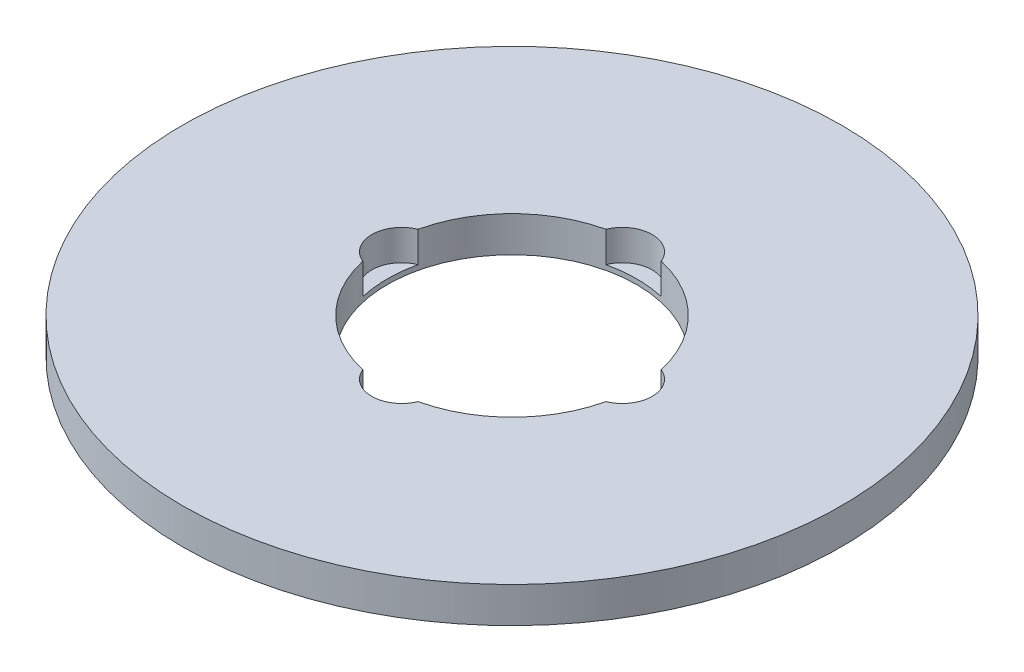
from build123d import *

# Parameters (mm, degrees)
SKETCH1_R           = 92.5
BOSS_EXTRUDE1_DEPTH = 10
SKETCH2_R           = 35
CUT_EXTRUDE1_DEPTH  = 132.196417634
SKETCH3_R           = 8.377036791
CUT_EXTRUDE2_DEPTH  = 8.603639824
CIRPATTERN1_COUNT   = 4


with BuildPart() as part:
    # Sketch1 → Boss-Extrude1 (new body)
    with BuildSketch(Plane(origin=(0, 0, 0), x_dir=(1, 0, 0), z_dir=(0, 1, 0))):
        Circle(SKETCH1_R)
    extrude(amount=BOSS_EXTRUDE1_DEPTH)

    # Sketch2 → Cut-Extrude1 (cut, through all)
    with BuildSketch(Plane(origin=(0, 0, 0), x_dir=(1, 0, 0), z_dir=(0, 1, 0))):
        Circle(SKETCH2_R)
    extrude(amount=CUT_EXTRUDE1_DEPTH, mode=Mode.SUBTRACT)

    # Sketch3 → Cut-Extrude2 (cut)
    with BuildSketch(Plane(origin=(0, 10, 0), x_dir=(1, 0, 0), z_dir=(0, 1, 0))):
        with Locations((-30.973990146, 0)):
            Circle(SKETCH3_R)
    cut_extrude2 = extrude(amount=-CUT_EXTRUDE2_DEPTH, mode=Mode.SUBTRACT)

    # CirPattern1: Cut-Extrude2 ×4 about axis
    cirpattern1_axis = Axis((0, 0, 0), (0, 1, 0))
    for i in range(1, CIRPATTERN1_COUNT):
        add(cut_extrude2.rotate(cirpattern1_axis, i * 360 / CIRPATTERN1_COUNT), mode=Mode.SUBTRACT)


solid = part.part
